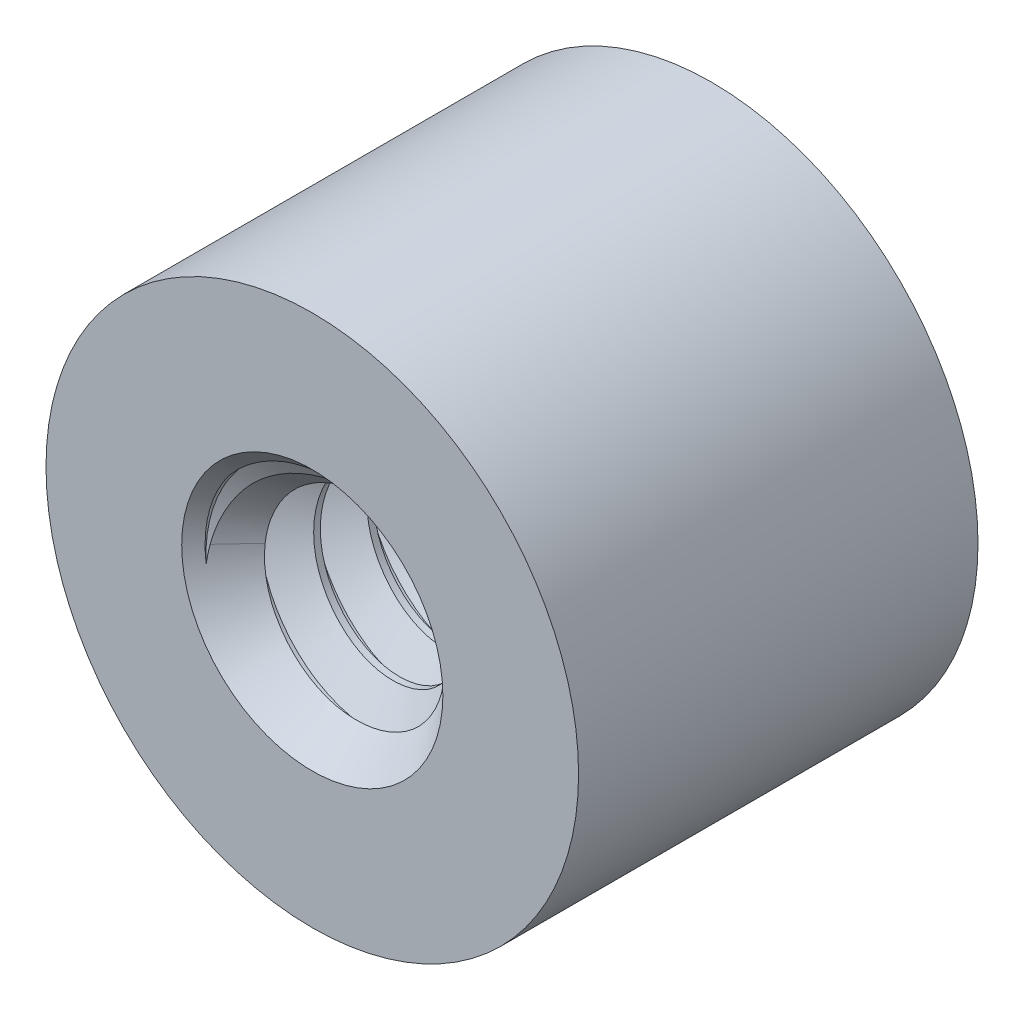
from build123d import *

# Parameters (mm, degrees)
EXTRUDE1_DEPTH      = 2.38125
EXTRUDE1_DEPTH_BACK = 2.38125
SKETCH1_R           = 3.175
SKETCH1_R_2         = 1.4224
SWEEP1_PITCH        = 0.635
SKETCH6_R           = 3.175
EXTRUDE2_DEPTH      = 8.318081472


with BuildPart() as part:
    # Sketch1 → Extrude1 (new, two sides: drawn at the far end of the back side and taken through both)
    with BuildSketch(Plane.XY.offset(-EXTRUDE1_DEPTH_BACK)):
        Circle(SKETCH1_R)
        Circle(SKETCH1_R_2, mode=Mode.SUBTRACT)
    extrude(amount=EXTRUDE1_DEPTH + EXTRUDE1_DEPTH_BACK)

    # Sweep1: the profile of Sketch12 profile screwed along a right-hand helix of 9.1 turns, 6 arcs to a turn; built about Z, then put on its axis
    sweep1_z = Axis((0, 0, 0), (0, 0, 1))
    sweep1_corners = [(1.4227, 0, -0.555798205), (1.4227, 0, 0.000173205), (1.009955401, 0, -0.238125), (1.009955401, 0, -0.3175)]
    with BuildLine(mode=Mode.PRIVATE) as sweep1_profile:
        Line(sweep1_corners[0], sweep1_corners[1])
        Line(sweep1_corners[1], sweep1_corners[2])
        Line(sweep1_corners[2], sweep1_corners[3])
        Line(sweep1_corners[3], sweep1_corners[0])
    sweep1_cap = Face(sweep1_profile.wire())
    sweep1_turn_angles = [0, 30, 60, 90, 120, 150, 180, 210, 240, 270, 300, 330, 360]
    sweep1_turn_weights = [1, 0.8660254037844387, 1, 0.8660254037844387, 1, 0.8660254037844387, 1, 0.8660254037844387, 1, 0.8660254037844387, 1, 0.8660254037844387, 1]
    sweep1_turn_rails = [Edge.make_bspline([Vector(p[0], p[1], 0).rotate(sweep1_z, sweep1_turn_angles[k]) / sweep1_turn_weights[k] + Vector(0, 0, p[2] + SWEEP1_PITCH * sweep1_turn_angles[k] / 360) for k in range(13)], [0, 0, 0, 1, 1, 2, 2, 3, 3, 4, 4, 5, 5, 6, 6, 6], 2, sweep1_turn_weights) for p in sweep1_corners]
    sweep1_turn_sides = [Face.make_surface_from_curves(sweep1_turn_rails[p[0]], sweep1_turn_rails[p[1]]) for p in [(0, 1), (1, 2), (2, 3), (3, 0)]]
    sweep1_last_angles = [3240, 3258, 3276]
    sweep1_last_weights = [1, 0.9510565162951523, 1]
    sweep1_last_rails = [Edge.make_bspline([Vector(p[0], p[1], 0).rotate(sweep1_z, sweep1_last_angles[k]) / sweep1_last_weights[k] + Vector(0, 0, p[2] + SWEEP1_PITCH * sweep1_last_angles[k] / 360) for k in range(3)], [0, 0, 0, 1, 1, 1], 2, sweep1_last_weights) for p in sweep1_corners]
    sweep1_last_sides = [Face.make_surface_from_curves(sweep1_last_rails[p[0]], sweep1_last_rails[p[1]]) for p in [(0, 1), (1, 2), (2, 3), (3, 0)]]
    sweep1 = Plane(origin=(0, 0, -2.38125), x_dir=(0, 1, 0), z_dir=(0, 0, 1)) * Solid(Shell([*[p.moved(Location((0, 0, SWEEP1_PITCH * i))) for i in range(9) for p in sweep1_turn_sides], *sweep1_last_sides, sweep1_cap, sweep1_cap.rotate(sweep1_z, 3276).moved(Location((0, 0, SWEEP1_PITCH * 3276 / 360)))]))
    add(sweep1)

    # Sketch6 → Extrude2 (cut, through all)
    with BuildSketch(Plane(origin=(0, 0, -2.38125), x_dir=(-1, 0, 0), z_dir=(0, 0, -1))):
        with Locations(Location((0, 0, 0), (0, 0, 180))):
            Circle(SKETCH6_R)
    extrude2 = extrude(amount=EXTRUDE2_DEPTH, mode=Mode.SUBTRACT)

    # Extrude3 cone 1 section (through the dimple's axis) → Extrude3 (revolve, cut)
    with BuildSketch(Plane(origin=(0, 0, -2.38125), x_dir=(0, 1, 0), z_dir=(1, 0, 0))):
        Polygon((0, 0), (1.55702, 0), (0, 1.669699529), align=None)
    extrude3 = revolve(axis=Axis((0, 0, -2.38125), (0, 0, 1)), mode=Mode.SUBTRACT)

    # Mirror1: Extrude2, Extrude3 across plane
    add(extrude2.mirror(Plane.XY), mode=Mode.SUBTRACT)
    add(extrude3.mirror(Plane.XY), mode=Mode.SUBTRACT)


solid = part.part
